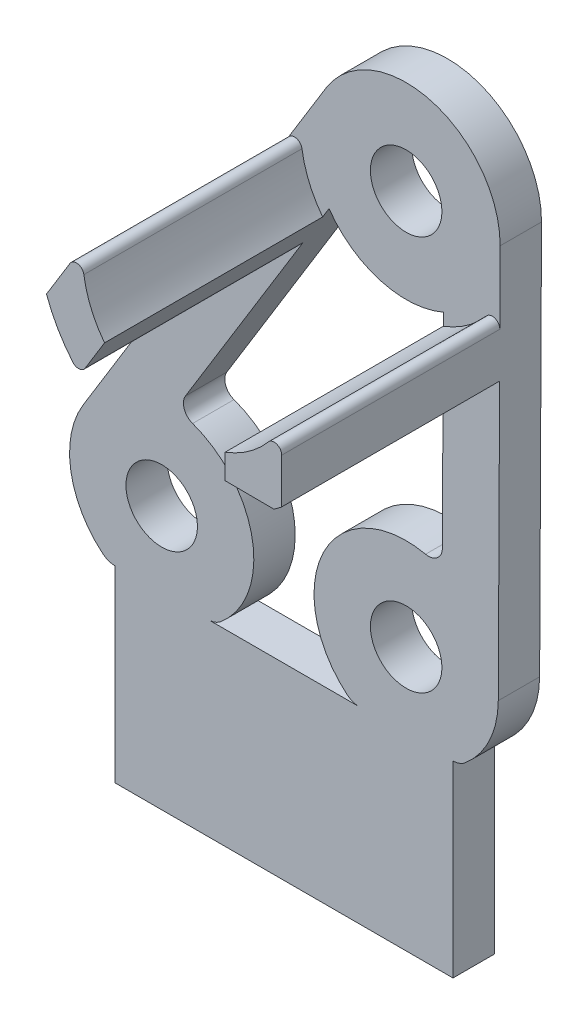
from build123d import *

# Parameters (mm, degrees)
STOCK_BASE_SKEWED_1_OUTLINE_R = 0.95
STOCK_BASE_SKEWED_1_DEPTH     = 1.1
STOCK_BASE_SKEWED_1_START     = 1.1
STOCK_BASE_SKEWED_1_2_DEPTH   = 5.8
SKETCH1_W                     = 5.8
SKETCH1_H                     = 0.6
CUT_EXTRUDE1_DEPTH            = 18.76345965


# Read off the part's stored shape, not the designer's step: Stock-Base_skewed-1
with BuildPart() as part:
    # Stock-Base_skewed-1 outline → Stock-Base_skewed-1 (new body)
    with BuildSketch(Plane.XY):
        with BuildLine():
            Line((8.949972222, -0.011666667), (8.999971655, 10.488095238))
            ThreePointArc((8.999971655, 10.488095238), (7.184905048, 12.904351279), (4.369026688, 11.807269193))
            Line((4.369026688, 11.807269193), (-2.088353846, 1.281123809))
            ThreePointArc((-2.088353846, 1.281123809), (-2.417250501, -0.399249317), (-1.565479113, -1.884615385))
            ThreePointArc((-1.565479113, -1.884615385), (-1.415835135, -1.970269972), (-1.245993579, -2))
            Line((-1.245993579, -2), (-1.245993579, -7))
            Line((-1.245993579, -7), (7.745993579, -7))
            Line((7.745993579, -7), (7.745993579, -2))
            ThreePointArc((7.745993579, -2), (7.915835135, -1.970269972), (8.065479113, -1.884615385))
            ThreePointArc((8.065479113, -1.884615385), (8.715388585, -1.046209071), (8.949972222, -0.011666667))
        make_face()
        with BuildLine():
            ThreePointArc((7.463119607, 2.75282442), (7.325518036, 2.467571215), (7.017292273, 2.394766941))
            ThreePointArc((7.017292273, 2.394766941), (4.297058288, 1.072169676), (4.934520887, -1.884615385))
            ThreePointArc((4.934520887, -1.884615385), (5.084164865, -1.970269972), (5.254006421, -2))
            Line((5.254006421, -2), (1.245993579, -2))
            ThreePointArc((1.245993579, -2), (1.415835135, -1.970269972), (1.565479113, -1.884615385))
            ThreePointArc((1.565479113, -1.884615385), (2.412392059, 0.427626653), (0.822306837, 2.307880297))
            ThreePointArc((0.822306837, 2.307880297), (0.598713954, 2.532178772), (0.632085047, 2.847123137))
            Line((0.632085047, 2.847123137), (4.449478669, 9.069838376))
            ThreePointArc((4.449478669, 9.069838376), (5.815094952, 8.095648721), (7.489077768, 8.203976226))
            Line((7.489077768, 8.203976226), (7.463119607, 2.75282442))
        make_face(mode=Mode.SUBTRACT)
        Circle(STOCK_BASE_SKEWED_1_OUTLINE_R, mode=Mode.SUBTRACT)
        with Locations((6.5, 0)):
            Circle(STOCK_BASE_SKEWED_1_OUTLINE_R, mode=Mode.SUBTRACT)
        with Locations((6.5, 10.5)):
            Circle(STOCK_BASE_SKEWED_1_OUTLINE_R, mode=Mode.SUBTRACT)
    extrude(amount=STOCK_BASE_SKEWED_1_DEPTH)

    # Stock-Base_skewed-1 2 outline → Stock-Base_skewed-1 2 (add)
    with BuildSketch(Plane.XY.offset(STOCK_BASE_SKEWED_1_START)):
        with BuildLine():
            Line((7.487534665, 7.879928382), (7.481545884, 6.622298661))
            ThreePointArc((7.481545884, 6.622298661), (8.272723591, 6.914271194), (8.985102612, 7.365631642))
            Line((8.985102612, 7.365631642), (8.990799579, 8.561981048))
            ThreePointArc((8.990799579, 8.561981048), (8.86000918, 8.750577627), (8.638081723, 8.6920712))
            ThreePointArc((8.638081723, 8.6920712), (8.114702276, 8.212482446), (7.487534665, 7.879928382))
        make_face()
        with BuildLine():
            Line((3.762240232, 7.94957426), (4.280029642, 8.793620321))
            ThreePointArc((4.280029642, 8.793620321), (3.922249334, 9.406747282), (3.73015902, 10.090145211))
            ThreePointArc((3.73015902, 10.090145211), (3.572375767, 10.256816274), (3.361835371, 10.165451404))
            Line((3.361835371, 10.165451404), (2.736247989, 9.14568438))
            ThreePointArc((2.736247989, 9.14568438), (3.033358957, 8.50440488), (3.438697229, 7.925427153))
            ThreePointArc((3.438697229, 7.925427153), (3.606647644, 7.854710493), (3.762240232, 7.94957426))
        make_face()
    extrude(amount=STOCK_BASE_SKEWED_1_2_DEPTH)

    # Sketch1 → Cut-Extrude1 (cut, through all)
    with BuildSketch(Plane(origin=(7.449841837, -0.03547584, 0), x_dir=(0, 0, 1), z_dir=(-0.999988662067245, 0.004761904761905177, 0))):
        with Locations((4, 6.957849986)):
            Rectangle(SKETCH1_W, SKETCH1_H)
    extrude(amount=-CUT_EXTRUDE1_DEPTH, mode=Mode.SUBTRACT)


solid = part.part
